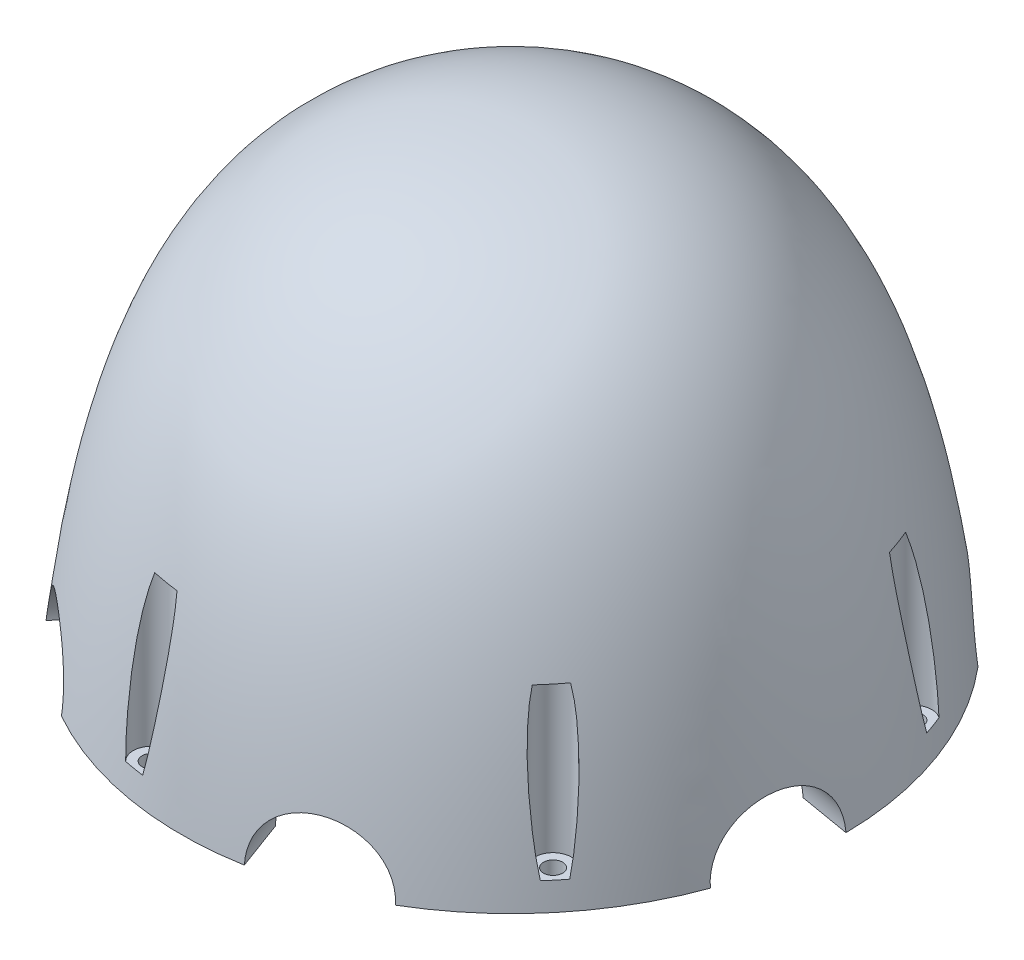
from build123d import *

# Parameters (mm, degrees)
SKETCH_2_R               = 1.651
CUT_EXTRUDE_2_DEPTH      = 94.427191555
SKETCH_3_R               = 3.175
CUT_EXTRUDE_3_DEPTH      = 26
CUT_EXTRUDE_6_DEPTH      = 172.450738832
PATTERN_CIRCULAR_1_COUNT = 3


with BuildPart() as part:
    # 草图1 → 旋转1 (revolve)
    with BuildSketch(Plane.XY):
        with BuildLine():
            Line((-48.26, 0), (-57.15, 0))
            add(Edge.make_bspline(
                [(-57.15, 0), (-53.272554224, 34.209036409), (-44.696037368, 77.34571337), (0, 77.34571337)],
                knots=[0, 0, 0, 0, 1, 1, 1, 1], degree=3))
            Line((0, 77.34571337), (0, 72.26571337))
            add(Edge.make_bspline(
                [(-48.26, 0), (-46.120003322, 40.762762671), (-36.851135765, 72.26571337), (0, 72.26571337)],
                knots=[0, 0, 0, 0, 1, 1, 1, 1], degree=3))
        make_face()
    revolve(axis=Axis((0, 0, 0), (0, 1, 0)))

    # 草图2 → 切除-拉伸2 (cut, through all)
    with BuildSketch(Plane(origin=(0, 30.48, 0), x_dir=(-1, 0, 0), z_dir=(0, -1, 0))):
        with Locations((41.548077849, 34.453705926)):
            Circle(SKETCH_2_R)
        with Locations((50.611823511, -18.754837933)):
            Circle(SKETCH_2_R)
        with Locations((9.063745662, -53.208543859)):
            Circle(SKETCH_2_R)
        with Locations((-41.548077849, -34.453705926)):
            Circle(SKETCH_2_R)
        with Locations((-50.611823511, 18.754837933)):
            Circle(SKETCH_2_R)
        with Locations((-9.063745662, 53.208543859)):
            Circle(SKETCH_2_R)
    extrude(amount=CUT_EXTRUDE_2_DEPTH, mode=Mode.SUBTRACT)

    # 草图3 → 切除-拉伸3 (cut)
    with BuildSketch(Plane(origin=(0, 30.48, 0), x_dir=(-1, 0, 0), z_dir=(0, -1, 0))):
        with Locations((41.548077849, 34.453705926)):
            Circle(SKETCH_3_R)
        with Locations((50.611823511, -18.754837933)):
            Circle(SKETCH_3_R)
        with Locations((9.063745662, -53.208543859)):
            Circle(SKETCH_3_R)
        with Locations((-41.548077849, -34.453705926)):
            Circle(SKETCH_3_R)
        with Locations((-50.611823511, 18.754837933)):
            Circle(SKETCH_3_R)
        with Locations((-9.063745662, 53.208543859)):
            Circle(SKETCH_3_R)
    extrude(amount=CUT_EXTRUDE_3_DEPTH, mode=Mode.SUBTRACT)

    # 草图4 → 切除-拉伸6 (cut, through all)
    with BuildSketch(Plane(origin=(-78.631059864, 0, -13.394313695), x_dir=(0.16792488488501636, 0, -0.9857997935870925), z_dir=(0.9857997935870924, 0, 0.16792488488501633))):
        with BuildLine():
            Line((10.16, 0), (-10.16, 0))
            ThreePointArc((-10.16, 0), (0, 10.16), (10.16, 0))
        make_face()
    cut_extrude_6 = extrude(amount=CUT_EXTRUDE_6_DEPTH, mode=Mode.SUBTRACT)

    # 阵列(圆周)1: 切除-拉伸6 ×3 about axis
    pattern_circular_1_axis = Axis((0, 0, 0), (0, -1, 0))
    for i in range(1, PATTERN_CIRCULAR_1_COUNT):
        add(cut_extrude_6.rotate(pattern_circular_1_axis, i * 360 / PATTERN_CIRCULAR_1_COUNT), mode=Mode.SUBTRACT)


solid = part.part
